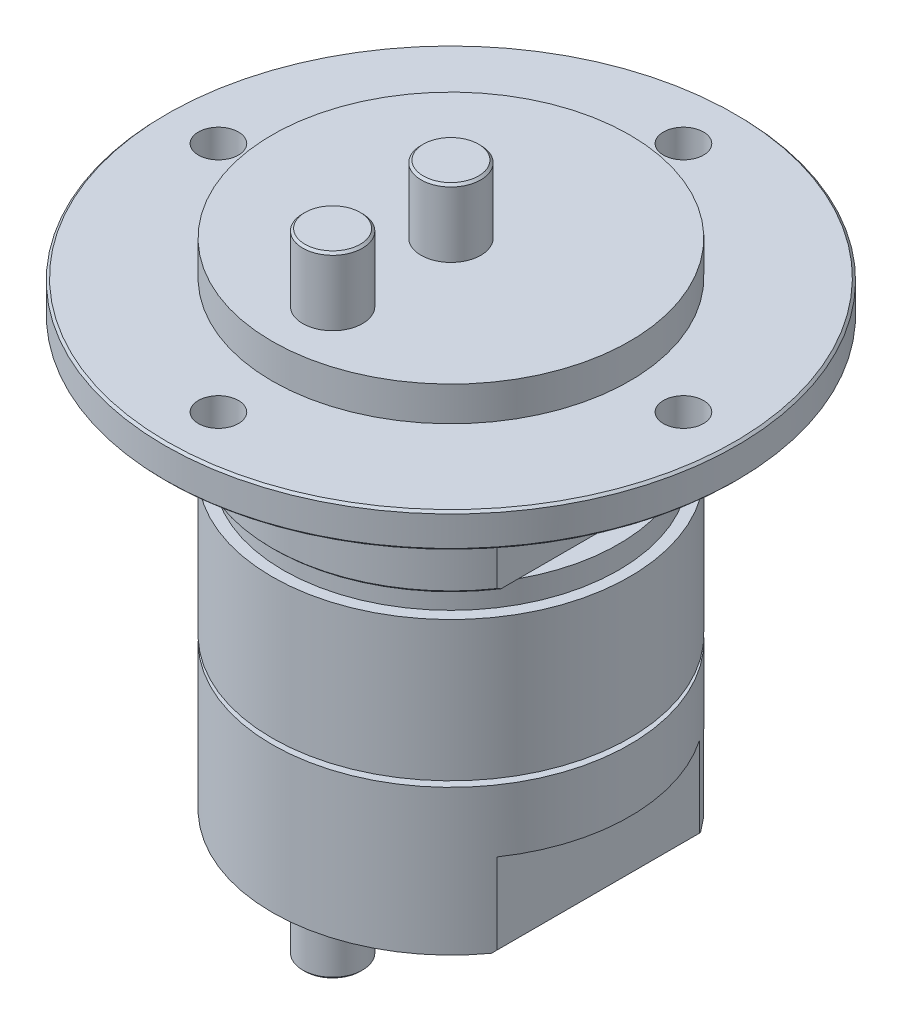
from build123d import *

# Parameters (mm, degrees)
BOSS_EXTRUDE1_DEPTH      = 6
BOSS_EXTRUDE1_DEPTH_BACK = 49.9
SKETCH2_R                = 2.65
SKETCH3_R                = 1.78
CUT_EXTRUDE1_DEPTH       = 6
SKETCH4_W                = 5.711822604
SKETCH4_H                = 7.4
CUT_EXTRUDE2_DEPTH       = 60.035942442
CHAMFER1_SIZE            = 0.2


with BuildPart() as part:
    # Sketch1 → Revolve1 (revolve)
    with BuildSketch(Plane.XY):
        Polygon((0, 3.05), (-15.875, 3.05), (-15.875, 0), (-25.4, 0), (-25.4, -3.05), (-15.875, -3.05), (-15.875, -13.05), (-14.875, -13.05), (-14.875, -15.05), (-15.875, -15.05), (-15.875, -27.45), (-14.875, -27.45), (-14.875, -27.95), (-15.875, -27.95), (-15.875, -40.85), (0, -40.85), align=None)
    revolve(axis=Axis((0, 50.719281348, 0), (0, -1, 0)))

    # Sketch2 → Boss-Extrude1 (add, two sides: drawn at the far end of the back side and taken through both)
    with BuildSketch(Plane(origin=(0, 3.05, 0), x_dir=(1, 0, 0), z_dir=(0, 1, 0)).offset(-BOSS_EXTRUDE1_DEPTH_BACK)):
        Circle(SKETCH2_R)
        with Locations((0, -10.5)):
            Circle(SKETCH2_R)
    extrude(amount=BOSS_EXTRUDE1_DEPTH + BOSS_EXTRUDE1_DEPTH_BACK)

    # Sketch3 → Cut-Extrude1 (cut)
    with BuildSketch(Plane(origin=(0, 0, 0), x_dir=(1, 0, 0), z_dir=(0, 1, 0))):
        with Locations((0, 20.64)):
            Circle(SKETCH3_R)
        with Locations((-20.64, 0)):
            Circle(SKETCH3_R)
        with Locations((0, -20.64)):
            Circle(SKETCH3_R)
        with Locations((20.64, 0)):
            Circle(SKETCH3_R)
    extrude(amount=-CUT_EXTRUDE1_DEPTH, mode=Mode.SUBTRACT)

    # Sketch4 → Cut-Extrude2 (cut, symmetric)
    with BuildSketch(Plane.XY):
        with Locations((-15.935911302, -9.35)):
            Rectangle(SKETCH4_W, SKETCH4_H)
        with Locations((-15.935911302, -37.184964336)):
            Rectangle(SKETCH4_W, SKETCH4_H)
    cut_extrude2 = extrude(amount=CUT_EXTRUDE2_DEPTH, both=True, mode=Mode.SUBTRACT)

    # Mirror1: Cut-Extrude2 across plane
    add(cut_extrude2.mirror(Plane(origin=(0, 0, 0), x_dir=(0, 0, 1), z_dir=(1, 0, 0))), mode=Mode.SUBTRACT)

    # Chamfer1
    chamfer1_edges = [part.edges().sort_by_distance(p)[0] for p in [
        (13.08, -40.85, 0),
        (-13.08, -40.85, 0),
        (-2.65, -46.85, 10.5),
        (-2.65, -46.85, 0),
        (-2.65, 9.05, 10.5),
        (-2.65, 9.05, 0),
        (25.4, -3.05, 0),
        (25.4, 0, 0),
        (0, -13.05, -15.875),
        (0, -13.05, 15.875),
    ]]
    chamfer(chamfer1_edges, length=CHAMFER1_SIZE)


solid = part.part
